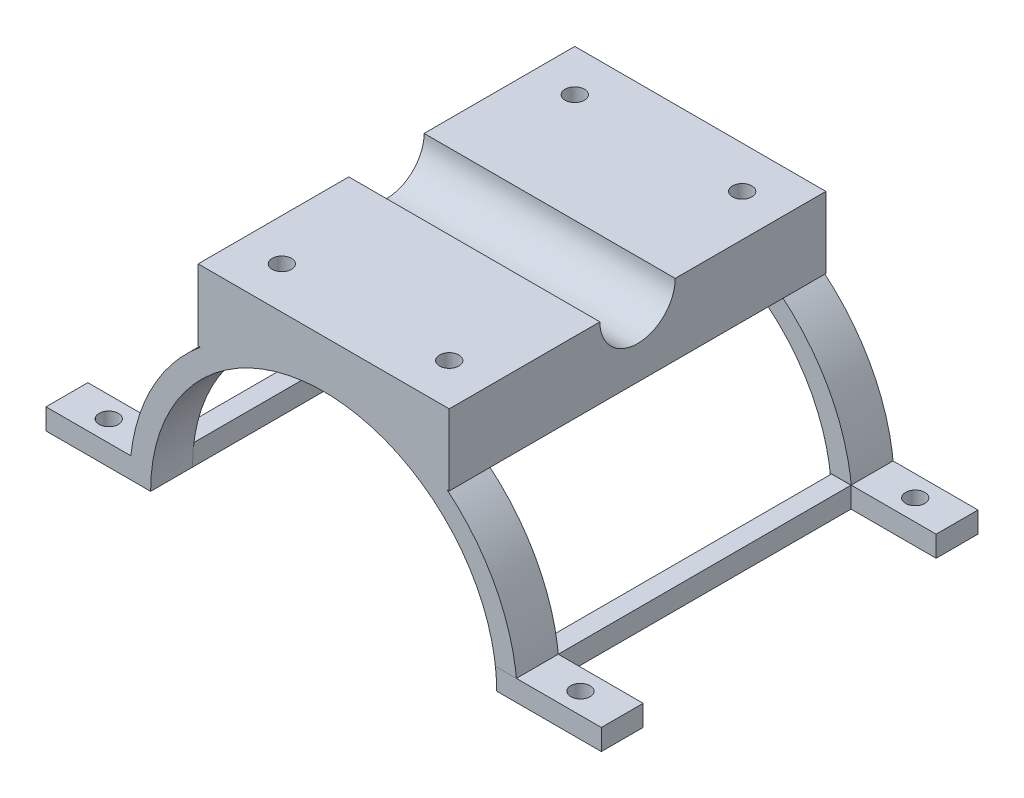
from build123d import *

# Parameters (mm, degrees)
BOSS_EXTRUDE1_DEPTH     = 10
SKETCH2_W               = 10
SKETCH2_H               = 5
BOSS_EXTRUDE2_DEPTH     = 66.35
SKETCH3_R               = 2.3
CUT_EXTRUDE1_DEPTH      = 132.7
SKETCH4_R               = 41.35
CUT_EXTRUDE3_DEPTH      = 50
LPATTERN4_START         = 80
LPATTERN4_DEPTH         = 10
LPATTERN4_2_DEPTH       = 10
LPATTERN4_3_DEPTH       = 10
MIRROR5_COPY_1_SKETCH_R = 2.3
MIRROR5_COPY_1_DEPTH    = 132.7
SKETCH8_W               = 4.648420871
SKETCH8_H               = 4.94728133
BOSS_EXTRUDE3_DEPTH     = 40
SKETCH11_W              = 60
SKETCH11_H              = 17
BOSS_EXTRUDE4_DEPTH     = 90
SKETCH12_R              = 41.35
CUT_EXTRUDE4_DEPTH      = 250
SKETCH14_R              = 2.3
CUT_EXTRUDE6_DEPTH      = 15
MIRROR8_COPY_1_SKETCH_R = 2.3
MIRROR8_COPY_1_DEPTH    = 15
SKETCH15_R              = 9
CUT_EXTRUDE7_DEPTH      = 67


# Read off the part's stored shape, not the designer's step: LPattern4
with BuildPart() as part:
    # Sketch1 → Boss-Extrude1 (new body)
    with BuildSketch(Plane.XY):
        with BuildLine():
            Line((-46.35, 0), (-41.35, 0))
            ThreePointArc((-41.35, 0), (0, 41.35), (41.35, 0))
            Line((41.35, 0), (46.35, 0))
            ThreePointArc((46.35, 0), (0, 46.35), (-46.35, 0))
        make_face()
    extrude(amount=BOSS_EXTRUDE1_DEPTH)



with BuildPart() as body_2:
    # Sketch2 → Boss-Extrude2 (new, symmetric)
    with BuildSketch(Plane(origin=(0, 0, 0), x_dir=(0, 0, -1), z_dir=(1, 0, 0))):
        with Locations((-5, 2.5)):
            Rectangle(SKETCH2_W, SKETCH2_H)
    extrude(amount=BOSS_EXTRUDE2_DEPTH, both=True)

    # Sketch3 → Cut-Extrude1 (cut)
    with BuildSketch(Plane(origin=(0, 5, 0), x_dir=(1, 0, 0), z_dir=(0, 1, 0))):
        with Locations(Location((56.35, -5, 0), (0, 0, 270))):
            Circle(SKETCH3_R)
    cut_extrude1 = extrude(amount=-CUT_EXTRUDE1_DEPTH, mode=Mode.SUBTRACT)

    # Mirror1: Cut-Extrude1 across plane
    add(cut_extrude1.mirror(Plane(origin=(0, 0, 0), x_dir=(0, 0, 1), z_dir=(1, 0, 0))), mode=Mode.SUBTRACT)

    # Sketch4 → Cut-Extrude3 (cut, symmetric)
    with BuildSketch(Plane.XY):
        Circle(SKETCH4_R)
    extrude(amount=CUT_EXTRUDE3_DEPTH, both=True, mode=Mode.SUBTRACT)


with BuildPart() as cut_extrude3_piece_1:
    # of the separate pieces the step leaves, piece 1, a body of its own (cut_extrude3_pieces)
    add(body_2.part.solids().sort_by_distance((-41.35, 0, 10))[0])


with BuildPart() as cut_extrude3_piece_2:
    # of the separate pieces the step leaves, piece 2, a body of its own (cut_extrude3_pieces)
    add(body_2.part.solids().sort_by_distance((66.35, 0, 10))[0])


with BuildPart() as body_4:
    # LPattern4 outline → LPattern4 (new body)
    with BuildSketch(Plane.XY.offset(LPATTERN4_START)):
        with BuildLine():
            Line((66.35, 0), (66.35, 5))
            Line((66.35, 5), (41.046589383, 5))
            ThreePointArc((41.046589383, 5), (41.274077646, 2.504598671), (41.35, 0))
            Line((41.35, 0), (66.35, 0))
        make_face()
    extrude(amount=LPATTERN4_DEPTH)

    # Mirror5: Cut-Extrude1 across plane
    add(cut_extrude1.mirror(Plane.XY.offset(45)), mode=Mode.SUBTRACT)


with BuildPart() as body_5:
    # LPattern4 2 outline → LPattern4 2 (new body)
    with BuildSketch(Plane.XY.offset(LPATTERN4_START)):
        with BuildLine():
            Line((-46.35, 0), (-41.35, 0))
            ThreePointArc((-41.35, 0), (0, 41.35), (41.35, 0))
            Line((41.35, 0), (46.35, 0))
            ThreePointArc((46.35, 0), (0, 46.35), (-46.35, 0))
        make_face()
    extrude(amount=LPATTERN4_2_DEPTH)


with BuildPart() as body_6:
    # LPattern4 3 outline → LPattern4 3 (new body)
    with BuildSketch(Plane.XY.offset(LPATTERN4_START)):
        with BuildLine():
            Line((-66.35, 0), (-41.35, 0))
            ThreePointArc((-41.35, 0), (-41.274077646, 2.504598671), (-41.046589383, 5))
            Line((-41.046589383, 5), (-66.35, 5))
            Line((-66.35, 5), (-66.35, 0))
        make_face()
    extrude(amount=LPATTERN4_3_DEPTH)

    # Mirror5 copy 1 sketch → Mirror5 copy 1 (cut)
    with BuildSketch(Plane(origin=(0, 5, 90), x_dir=(-1, 0, 0), z_dir=(0, 1, 0))):
        with Locations(Location((56.35, -5, 0), (0, 0, 270))):
            Circle(MIRROR5_COPY_1_SKETCH_R)
    extrude(amount=-MIRROR5_COPY_1_DEPTH, mode=Mode.SUBTRACT)


with BuildPart() as part_1:
    add(part.part)

    add(cut_extrude3_piece_1.part)  # Boss-Extrude3 merges Cut-Extrude3 piece 1

    add(body_5.part)  # Boss-Extrude3 merges body 5

    add(body_6.part)  # Boss-Extrude3 merges body 6
    # Sketch8 → Boss-Extrude3 (add, symmetric)
    with BuildSketch(Plane.XY.offset(45)):
        with Locations((-43.674210436, 2.473640665)):
            Rectangle(SKETCH8_W, SKETCH8_H)
    boss_extrude3 = extrude(amount=BOSS_EXTRUDE3_DEPTH, both=True)

    # Mirror6: Boss-Extrude3 across plane
    add(boss_extrude3.mirror(Plane(origin=(0, 0, 0), x_dir=(0, 0, 1), z_dir=(1, 0, 0))))

    # Sketch11 → Boss-Extrude4 (add)
    with BuildSketch(Plane.XY.offset(90)):
        with Locations((0, 44.255632839)):
            Rectangle(SKETCH11_W, SKETCH11_H)
    extrude(amount=-BOSS_EXTRUDE4_DEPTH)

    # Sketch12 → Cut-Extrude4 (cut, symmetric)
    with BuildSketch(Plane.XY.offset(90)):
        Circle(SKETCH12_R)
    extrude(amount=CUT_EXTRUDE4_DEPTH, both=True, mode=Mode.SUBTRACT)

    # Sketch14 → Cut-Extrude6 (cut, symmetric)
    with BuildSketch(Plane(origin=(0, 52.755632839, 0), x_dir=(1, 0, 0), z_dir=(0, 1, 0))):
        with Locations(Location((20, -80, 0), (0, 0, 270))):
            Circle(SKETCH14_R)
    cut_extrude6 = extrude(amount=CUT_EXTRUDE6_DEPTH, both=True, mode=Mode.SUBTRACT)

    # Mirror7: Cut-Extrude6 across plane
    add(cut_extrude6.mirror(Plane(origin=(0, 0, 0), x_dir=(0, 0, 1), z_dir=(1, 0, 0))), mode=Mode.SUBTRACT)

    # Mirror8: Cut-Extrude6 across plane
    add(cut_extrude6.mirror(Plane.XY.offset(45)), mode=Mode.SUBTRACT)

    # Mirror8 copy 1 sketch → Mirror8 copy 1 (cut, symmetric)
    with BuildSketch(Plane(origin=(0, 52.755632839, 90), x_dir=(-1, 0, 0), z_dir=(0, 1, 0))):
        with Locations(Location((20, -80, 0), (0, 0, 270))):
            Circle(MIRROR8_COPY_1_SKETCH_R)
    extrude(amount=MIRROR8_COPY_1_DEPTH, both=True, mode=Mode.SUBTRACT)

    # Sketch15 → Cut-Extrude7 (cut)
    with BuildSketch(Plane.ZY.offset(30)):
        with Locations((45, 52.755632839)):
            Circle(SKETCH15_R)
    extrude(amount=-CUT_EXTRUDE7_DEPTH, mode=Mode.SUBTRACT)


solid = Compound([cut_extrude3_piece_2.part, body_4.part, part_1.part])
